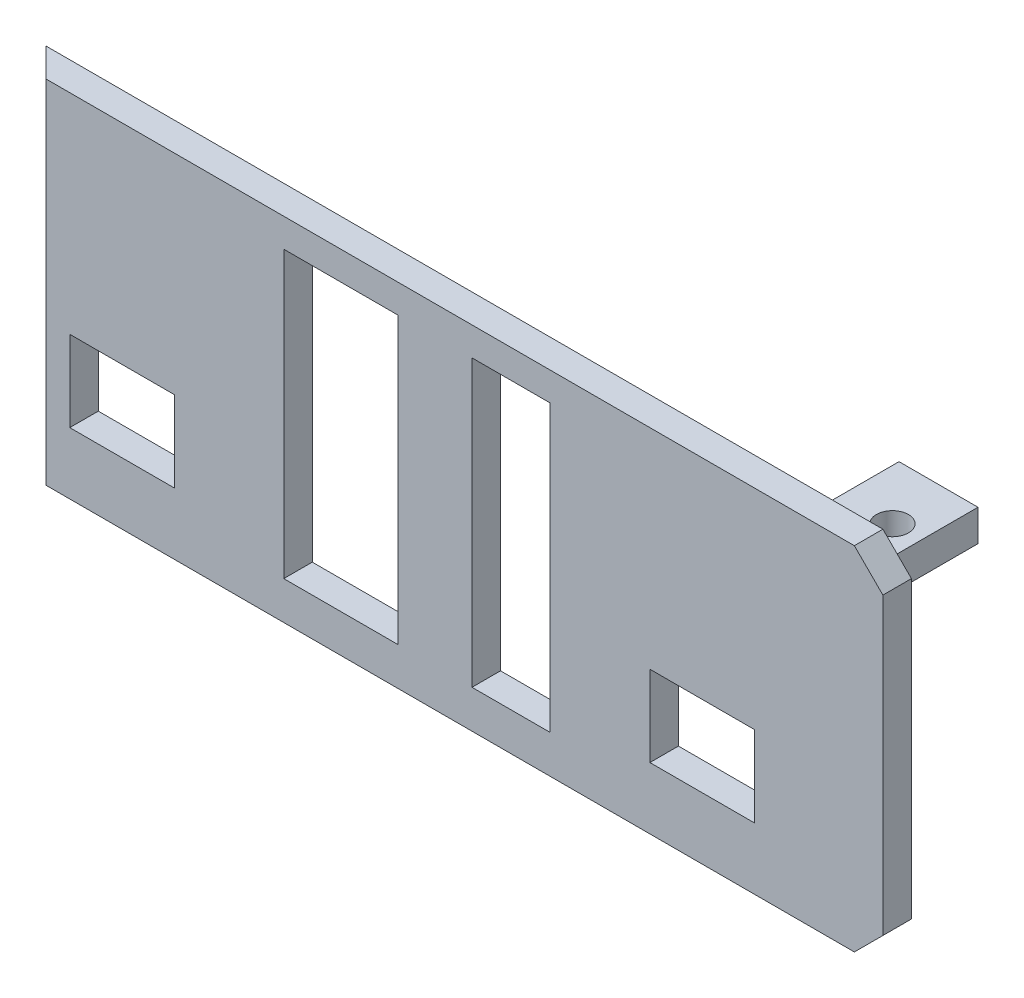
from build123d import *

# Parameters (mm, degrees)
SKETCH_1_W          = 91
SKETCH_1_H          = 37
EXTRUDE_1_DEPTH     = 3
CHAMFER_1_SIZE      = 3
SKETCH_2_W          = 11
SKETCH_2_H          = 8.5
CUT_EXTRUDE_1_DEPTH = 10
SKETCH_3_W          = 12
SKETCH_3_H          = 30
SKETCH_3_W_2        = 8.207535441
CUT_EXTRUDE_2_DEPTH = 10
SKETCH_4_W          = 8.305337468
SKETCH_4_H          = 3.319312894
EXTRUDE_2_DEPTH     = 10
SKETCH_5_R          = 1.683787266
CUT_EXTRUDE_3_DEPTH = 10
CHAMFER_2_SIZE      = 3
CHAMFER_3_SIZE      = 3


with BuildPart() as part:
    # 草图1 → 凸台-拉伸1 (new body)
    with BuildSketch(Plane.XY):
        Rectangle(SKETCH_1_W, SKETCH_1_H)
    extrude(amount=EXTRUDE_1_DEPTH)

    # 倒角1
    chamfer_1_edges = [part.edges().sort_by_distance(p)[0] for p in [
        (-45.5, 0, 3),
    ]]
    chamfer(chamfer_1_edges, length=CHAMFER_1_SIZE - 0.0001)  # a hair under: the kernel refuses the full size

    # 草图2 → 切除-拉伸1 (cut)
    with BuildSketch(Plane.XY.offset(3)):
        with Locations((-34.5, -7.75)):
            Rectangle(SKETCH_2_W, SKETCH_2_H)
        with Locations((26.5, -7.75)):
            Rectangle(SKETCH_2_W, SKETCH_2_H)
    extrude(amount=-CUT_EXTRUDE_1_DEPTH, mode=Mode.SUBTRACT)

    # 草图3 → 切除-拉伸2 (cut)
    with BuildSketch(Plane(origin=(0, 0, 0), x_dir=(-1, 0, 0), z_dir=(0, 0, -1))):
        with Locations((11.5, 0.5)):
            Rectangle(SKETCH_3_W, SKETCH_3_H)
        with Locations((-6.39623228, 0.5)):
            Rectangle(SKETCH_3_W_2, SKETCH_3_H)
    extrude(amount=-CUT_EXTRUDE_2_DEPTH, mode=Mode.SUBTRACT)

    # 草图4 → 凸台-拉伸2 (add)
    with BuildSketch(Plane(origin=(0, 0, 0), x_dir=(-1, 0, 0), z_dir=(0, 0, -1))):
        with Locations((-38.347331266, 13.840343553)):
            Rectangle(SKETCH_4_W, SKETCH_4_H)
    extrude(amount=EXTRUDE_2_DEPTH)

    # 草图5 → 切除-拉伸3 (cut)
    with BuildSketch(Plane(origin=(0, 15.5, 0), x_dir=(1, 0, 0), z_dir=(0, 1, 0))):
        with Locations(Location((39.5, 4, 0), (0, 0, 270))):
            Circle(SKETCH_5_R)
    extrude(amount=-CUT_EXTRUDE_3_DEPTH, mode=Mode.SUBTRACT)

    # 倒角2
    chamfer_2_edges = [part.edges().sort_by_distance(p)[0] for p in [
        (45.5, 18.5, 1.5),
    ]]
    chamfer(chamfer_2_edges, length=CHAMFER_2_SIZE)

    # 倒角3
    chamfer_3_edges = [part.edges().sort_by_distance(p)[0] for p in [
        (45.5, -18.5, 1.5),
    ]]
    chamfer(chamfer_3_edges, length=CHAMFER_3_SIZE)


solid = part.part
